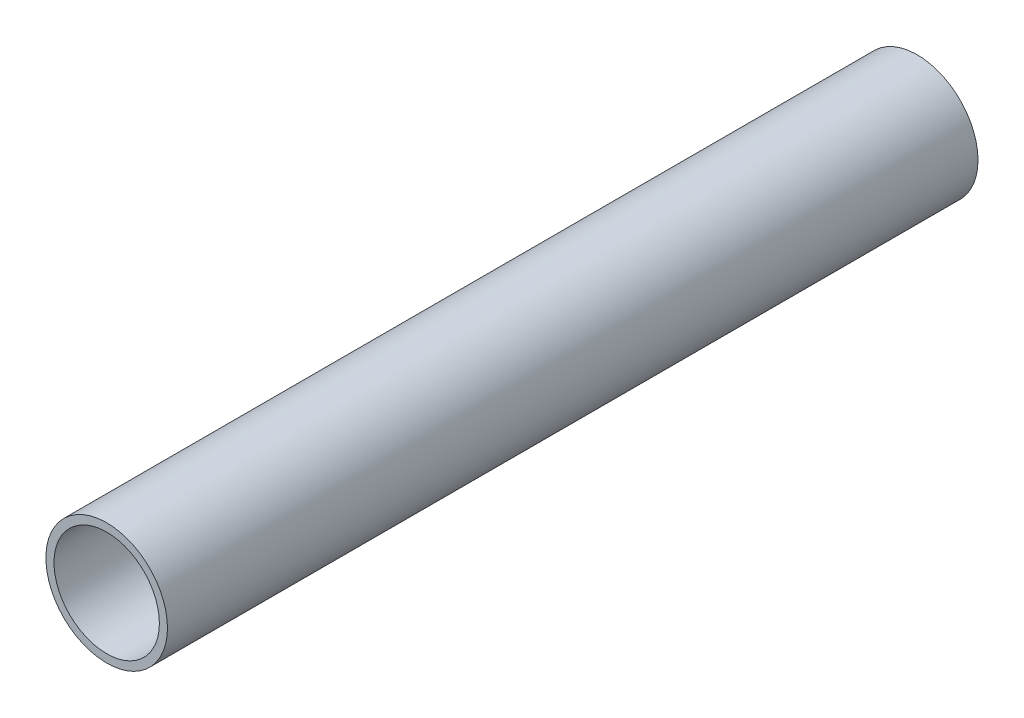
from build123d import *

# Parameters (mm, degrees)
SKETCH1_R           = 19.05
SKETCH1_R_2         = 16.51
EXTRUDE_THIN1_DEPTH = 254


with BuildPart() as part:
    # Sketch1 → Extrude-Thin1 (new body)
    with BuildSketch(Plane.XY):
        Circle(SKETCH1_R)
        Circle(SKETCH1_R_2, mode=Mode.SUBTRACT)
    extrude(amount=-EXTRUDE_THIN1_DEPTH)


solid = part.part
